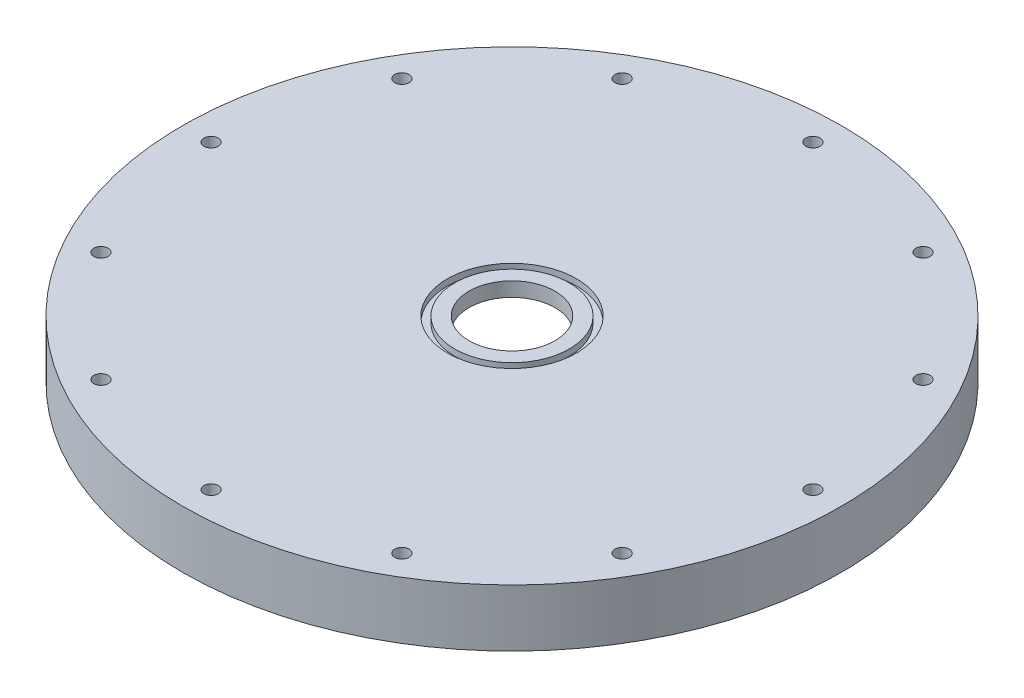
from build123d import *

# Parameters (mm, degrees)
SKETCH2_R                   = 19.05
CUT_EXTRUDE1_DEPTH          = 209.101814024
SKETCH3_R                   = 28.575
SKETCH3_R_2                 = 25.4
CUT_EXTRUDE2_DEPTH          = 2.794
F_1_4_0_25_DIAMETER_HOLE1_D = 6.35


with BuildPart() as part:
    # Sketch1 → Revolve1 (revolve)
    with BuildSketch(Plane.XY):
        with BuildLine():
            Line((0, 0), (0, 6.35))
            Line((0, 6.35), (-146.05, 6.35))
            Line((-146.05, 6.35), (-146.05, -19.05))
            Line((-146.05, -19.05), (-112.522, -19.05))
            Line((-112.522, -19.05), (-112.522, -16.51))
            ThreePointArc((-112.522, -16.51), (-107.686332957, -4.835667043), (-96.012, 0))
            Line((-96.012, 0), (0, 0))
        make_face()
    revolve(axis=Axis((0, 0, 0), (0, 1, 0)))

    # Sketch2 → Cut-Extrude1 (cut, through all)
    with BuildSketch(Plane(origin=(0, 6.35, 0), x_dir=(1, 0, 0), z_dir=(0, 1, 0))):
        Circle(SKETCH2_R)
    extrude(amount=-CUT_EXTRUDE1_DEPTH, mode=Mode.SUBTRACT)

    # Sketch3 → Cut-Extrude2 (cut)
    with BuildSketch(Plane(origin=(0, 6.35, 0), x_dir=(1, 0, 0), z_dir=(0, 1, 0))):
        Circle(SKETCH3_R)
        Circle(SKETCH3_R_2, mode=Mode.SUBTRACT)
    extrude(amount=-CUT_EXTRUDE2_DEPTH, mode=Mode.SUBTRACT)

    # 1/4 (0.25) Diameter Hole1 (through all)
    with Locations(Plane(origin=(0, 6.35, -133.35), x_dir=(0, 0, 1), z_dir=(0, 1, 0))):
        with Locations((0, 0), (17.865512405, -66.675), (66.675, -115.484487595), (133.35, -133.35), (200.025, -115.484487595), (248.834487595, -66.675), (266.7, 0), (248.834487595, 66.675), (200.025, 115.484487595), (133.35, 133.35), (66.675, 115.484487595), (17.865512405, 66.675)):
            Hole(F_1_4_0_25_DIAMETER_HOLE1_D / 2)


solid = part.part
